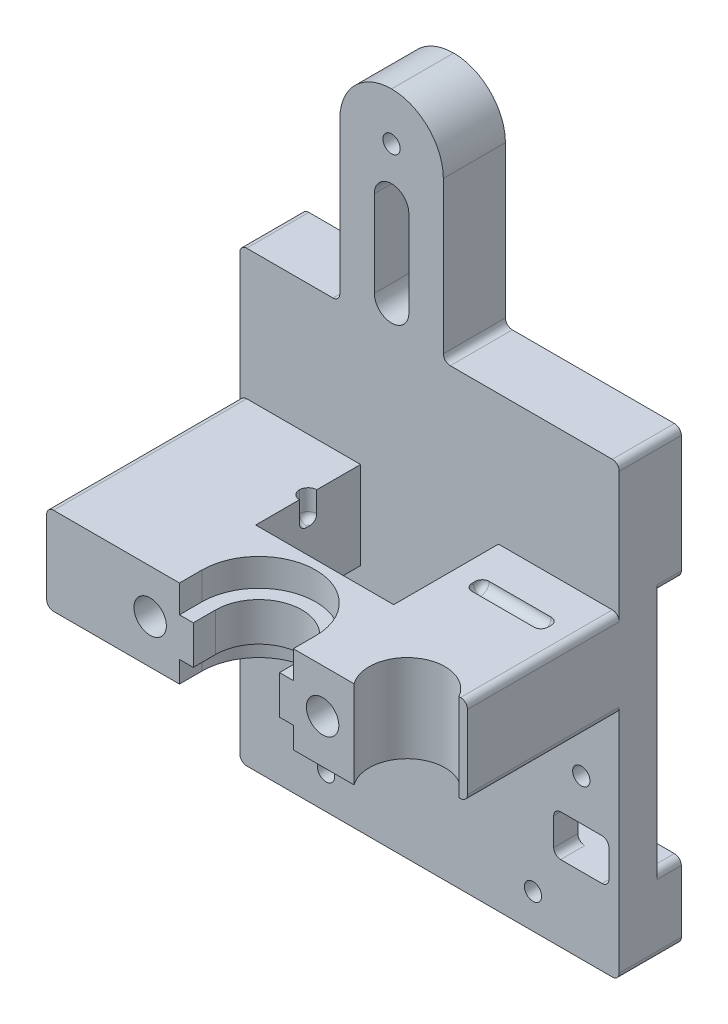
from build123d import *

# Parameters (mm, degrees)
SKETCH1_R           = 1.25
SKETCH1_W           = 8
SKETCH1_H           = 6
BOSS_EXTRUDE1_DEPTH = 9
FILLET1_R           = 7.5
FILLET2_R           = 1
BOSS_EXTRUDE2_DEPTH = 12.7
SKETCH3_W           = 2
SKETCH3_H           = 4
SKETCH3_H_2         = 3.1
SKETCH5_R           = 1.75
CUT_EXTRUDE1_DEPTH  = 10
SKETCH6_R           = 2.35
CUT_EXTRUDE2_DEPTH  = 5
SKETCH7_W           = 2.5
SKETCH7_H           = 4
CUT_EXTRUDE3_DEPTH  = 1.25
FILLET3_R           = 1.25
FILLET4_R           = 1
SKETCH8_W           = 11
SKETCH8_H           = 2.5
CUT_EXTRUDE4_DEPTH  = 1.25
FILLET5_R           = 1.25
FILLET6_R           = 1
SKETCH9_R           = 1.5
CUT_EXTRUDE5_DEPTH  = 8
SKETCH9_3_R         = 2.35
CUT_EXTRUDE6_DEPTH  = 5
SKETCH9_4_R         = 1.25
CUT_EXTRUDE7_DEPTH  = 23
SKETCH10_R          = 1.5
CUT_EXTRUDE8_DEPTH  = 8
SKETCH11_W          = 11
SKETCH11_H          = 35
CUT_EXTRUDE9_DEPTH  = 3.5
SKETCH13_W          = 9.4
SKETCH13_H          = 12
CUT_EXTRUDE10_DEPTH = 1.5
CUT_EXTRUDE11_DEPTH = 33
SKETCH15_W          = 2
SKETCH15_H          = 6
CUT_EXTRUDE12_DEPTH = 1.5
FILLET7_R           = 1
SKETCH16_W          = 8
SKETCH16_H          = 6
CUT_EXTRUDE13_DEPTH = 7.5
CUT_EXTRUDE14_DEPTH = 6
FILLET8_R           = 1


with BuildPart() as part:
    # Sketch1 → Boss-Extrude1 (new body)
    with BuildSketch(Plane.XY):
        Polygon((-27.5, 17.25), (-13, 17.25), (-13, 47.75), (2, 47.75), (2, 17.25), (27.5, 17.25), (27.5, -47.75), (-27.5, -47.75), align=None)
        with Locations((-5.5, 40.85)):
            Circle(SKETCH1_R, mode=Mode.SUBTRACT)
        with Locations((-22, -24.75)):
            Circle(SKETCH1_R, mode=Mode.SUBTRACT)
        with Locations((-15, -42.75)):
            Circle(SKETCH1_R, mode=Mode.SUBTRACT)
        with Locations(Location((15, -42.75, 0), (0, 0, 180))):
            Circle(SKETCH1_R, mode=Mode.SUBTRACT)
        with Locations(Location((22, -24.75, 0), (0, 0, 180))):
            Circle(SKETCH1_R, mode=Mode.SUBTRACT)
        with BuildLine():
            Line((-3, 33.35), (-3, 20.85))
            ThreePointArc((-3, 20.85), (-5.5, 18.35), (-8, 20.85))
            Line((-8, 20.85), (-8, 33.35))
            ThreePointArc((-8, 33.35), (-5.5, 35.85), (-3, 33.35))
        make_face(mode=Mode.SUBTRACT)
        with Locations((22, -33.75)):
            Rectangle(SKETCH1_W, SKETCH1_H, mode=Mode.SUBTRACT)
    extrude(amount=BOSS_EXTRUDE1_DEPTH)

    # Fillet1
    fillet1_edges = [part.edges().sort_by_distance(p)[0] for p in [
        (-13, 47.75, 4.5),
        (2, 47.75, 4.5),
    ]]
    fillet(fillet1_edges, radius=FILLET1_R - 0.0001)  # a hair under: the kernel refuses the full size

    # Fillet2
    fillet2_edges = [part.edges().sort_by_distance(p)[0] for p in [
        (-27.5, 17.25, 4.5),
        (-13, 17.25, 4.5),
        (2, 17.25, 4.5),
        (27.5, 17.25, 4.5),
        (27.5, -47.75, 4.5),
        (-27.5, -47.75, 4.5),
    ]]
    fillet(fillet2_edges, radius=FILLET2_R)

    # Sketch2 → Boss-Extrude2 (add)
    with BuildSketch(Plane(origin=(0, -14.35, 0), x_dir=(-1, 0, 0), z_dir=(0, -1, 0))):
        with BuildLine():
            Line((27.5, -9), (10, -9))
            Line((10, -9), (10, -24.2))
            Line((10, -24.2), (-10, -24.2))
            Line((-10, -24.2), (-10, -9))
            Line((-10, -9), (-27.5, -9))
            Line((-27.5, -9), (-27.5, -31))
            Line((-27.5, -31), (-26.263139721, -31))
            ThreePointArc((-26.263139721, -31), (-18.495572929, -29.143111899), (-17.062940163, -37))
            Line((-17.062940163, -37), (-6.25, -37))
            Line((-6.25, -37), (-6.25, -33.75))
            ThreePointArc((-6.25, -33.75), (0, -27.5), (6.25, -33.75))
            Line((6.25, -33.75), (6.25, -37))
            Line((6.25, -37), (27.5, -37))
            Line((27.5, -37), (27.5, -9))
        make_face()
    extrude(amount=-BOSS_EXTRUDE2_DEPTH)

    # Cut-Sweep1: sweep along a path in Sketch4
    with BuildLine(Plane(origin=(0, -1.65, 0), x_dir=(1, 0, 0), z_dir=(0, 1, 0))) as cut_sweep1_path:
        Line((-6.25, -37), (-6.25, -33.75))
        ThreePointArc((-6.25, -33.75), (0, -27.5), (6.25, -33.75))
        Line((6.25, -33.75), (6.25, -37))
    # Sketch3 → Cut-Sweep1 (sweep, cut)
    with BuildSketch(Plane.XY.offset(37)):
        with Locations((-7.25, -3.65)):
            Rectangle(SKETCH3_W, SKETCH3_H)
        with Locations((-7.25, -12.8)):
            Rectangle(SKETCH3_W, SKETCH3_H_2)
    sweep(path=cut_sweep1_path.line, mode=Mode.SUBTRACT)

    # Sketch5 → Cut-Extrude1 (cut)
    with BuildSketch(Plane.XY.offset(37)):
        with Locations((-12.5, -8)):
            Circle(SKETCH5_R)
        with Locations(Location((12.5, -8, 0), (0, 0, 180))):
            Circle(SKETCH5_R)
    extrude(amount=-CUT_EXTRUDE1_DEPTH, mode=Mode.SUBTRACT)

    # Sketch6 → Cut-Extrude2 (cut)
    with BuildSketch(Plane.XY.offset(37)):
        with Locations((-12.5, -8)):
            Circle(SKETCH6_R)
        with Locations((12.5, -8)):
            Circle(SKETCH6_R)
    extrude(amount=-CUT_EXTRUDE2_DEPTH, mode=Mode.SUBTRACT)

    # Sketch7 → Cut-Extrude3 (cut)
    with BuildSketch(Plane(origin=(-10, 0, 0), x_dir=(0, 0, -1), z_dir=(1, 0, 0))):
        with Locations((-16.6, -3.65)):
            Rectangle(SKETCH7_W, SKETCH7_H)
    extrude(amount=-CUT_EXTRUDE3_DEPTH, mode=Mode.SUBTRACT)

    # Fillet3
    fillet3_edges = [part.edges().sort_by_distance(p)[0] for p in [
        (-11.25, -3.65, 17.85),
        (-11.25, -3.65, 15.35),
    ]]
    fillet(fillet3_edges, radius=FILLET3_R - 0.0001)  # a hair under: the kernel refuses the full size

    # Fillet4
    fillet4_edges = [part.edges().sort_by_distance(p)[0] for p in [
        (-10.883912766, -5.65, 15.716087234),
        (-10.883912766, -5.65, 17.483912766),
    ]]
    fillet(fillet4_edges, radius=FILLET4_R)

    # Sketch8 → Cut-Extrude4 (cut)
    with BuildSketch(Plane(origin=(0, -1.65, 0), x_dir=(1, 0, 0), z_dir=(0, 1, 0))):
        with Locations((18.5, -15.6)):
            Rectangle(SKETCH8_W, SKETCH8_H)
    extrude(amount=-CUT_EXTRUDE4_DEPTH, mode=Mode.SUBTRACT)

    # Fillet5
    fillet5_edges = [part.edges().sort_by_distance(p)[0] for p in [
        (18.5, -2.9, 16.85),
        (18.5, -2.9, 14.35),
    ]]
    fillet(fillet5_edges, radius=FILLET5_R - 0.0001)  # a hair under: the kernel refuses the full size

    # Fillet6
    fillet6_edges = [part.edges().sort_by_distance(p)[0] for p in [
        (24, -2.533912766, 14.716087234),
        (24, -2.533912766, 16.483912766),
        (13, -2.533912766, 14.716087234),
        (13, -2.533912766, 16.483912766),
    ]]
    fillet(fillet6_edges, radius=FILLET6_R)

    # Sketch9 → Cut-Extrude5 (cut)
    with BuildSketch(Plane(origin=(0, 0, 0), x_dir=(-1, 0, 0), z_dir=(0, 0, -1))):
        with Locations((-12, -3.25)):
            Circle(SKETCH9_R)
        with Locations((-12, -27.25)):
            Circle(SKETCH9_R)
        with Locations(Location((12, -27.25, 0), (0, 0, 180))):
            Circle(SKETCH9_R)
        with Locations(Location((12, -3.25, 0), (0, 0, 180))):
            Circle(SKETCH9_R)
    extrude(amount=-CUT_EXTRUDE5_DEPTH, mode=Mode.SUBTRACT)

    # Sketch9<3> → Cut-Extrude6 (cut)
    with BuildSketch(Plane(origin=(0, 0, 0), x_dir=(-1, 0, 0), z_dir=(0, 0, -1))):
        with Locations((0, -15.25)):
            Circle(SKETCH9_3_R)
    extrude(amount=-CUT_EXTRUDE6_DEPTH, mode=Mode.SUBTRACT)

    # Sketch9<4> → Cut-Extrude7 (cut)
    with BuildSketch(Plane(origin=(0, 0, 0), x_dir=(-1, 0, 0), z_dir=(0, 0, -1))):
        with Locations((-22, -5.75)):
            Circle(SKETCH9_4_R)
        with Locations(Location((22, -5.75, 0), (0, 0, 180))):
            Circle(SKETCH9_4_R)
    extrude(amount=-CUT_EXTRUDE7_DEPTH, mode=Mode.SUBTRACT)

    # Sketch10 → Cut-Extrude8 (cut)
    with BuildSketch(Plane(origin=(0, 0, 0), x_dir=(-1, 0, 0), z_dir=(0, 0, -1))):
        with Locations((0, -15.25)):
            Circle(SKETCH10_R)
    extrude(amount=-CUT_EXTRUDE8_DEPTH, mode=Mode.SUBTRACT)

    # Sketch11 → Cut-Extrude9 (cut)
    with BuildSketch(Plane(origin=(0, 0, 0), x_dir=(-1, 0, 0), z_dir=(0, 0, -1))):
        with Locations((-22, -19.25)):
            Rectangle(SKETCH11_W, SKETCH11_H)
    cut_extrude9 = extrude(amount=-CUT_EXTRUDE9_DEPTH, mode=Mode.SUBTRACT)

    # Sketch13 → Cut-Extrude10 (cut)
    with BuildSketch(Plane(origin=(0, 0, 3.5), x_dir=(-1, 0, 0), z_dir=(0, 0, -1))):
        with Locations((-22, -15.25)):
            Rectangle(SKETCH13_W, SKETCH13_H)
    cut_extrude10 = extrude(amount=-CUT_EXTRUDE10_DEPTH, mode=Mode.SUBTRACT)

    # Mirror1: Cut-Extrude9, Cut-Extrude10 across plane
    add(cut_extrude9.mirror(Plane(origin=(0, 0, 0), x_dir=(0, 0, 1), z_dir=(1, 0, 0))), mode=Mode.SUBTRACT)
    add(cut_extrude10.mirror(Plane(origin=(0, 0, 0), x_dir=(0, 0, 1), z_dir=(1, 0, 0))), mode=Mode.SUBTRACT)

    # Sketch12 → Cut-Extrude11 (cut)
    with BuildSketch(Plane(origin=(16.5, 0, 0), x_dir=(0, 0, -1), z_dir=(1, 0, 0))):
        Polygon((-3.5, -30.75), (-2.5, -30.75), (-2.5, -36.75), (-5.5, -36.75), (-5.5, -30.75), align=None)
    extrude(amount=-CUT_EXTRUDE11_DEPTH, mode=Mode.SUBTRACT)

    # Sketch15 → Cut-Extrude12 (cut)
    with BuildSketch(Plane(origin=(18, 0, 0), x_dir=(0, 0, -1), z_dir=(1, 0, 0))):
        with Locations((-4.5, -33.75)):
            Rectangle(SKETCH15_W, SKETCH15_H)
    extrude(amount=-CUT_EXTRUDE12_DEPTH, mode=Mode.SUBTRACT)

    # Fillet7
    fillet7_edges = [part.edges().sort_by_distance(p)[0] for p in [
        (27.5, -36.75, 1.75),
        (27.5, -1.75, 1.75),
        (18, -30.75, 7.25),
        (-27.5, -1.75, 1.75),
        (-27.5, -36.75, 1.75),
        (18, -36.75, 7.25),
        (26, -36.75, 6.25),
        (26, -30.75, 6.25),
    ]]
    fillet(fillet7_edges, radius=FILLET7_R)

    # Sketch16 → Cut-Extrude13 (cut)
    with BuildSketch(Plane(origin=(0, 0, 0), x_dir=(-1, 0, 0), z_dir=(0, 0, -1))):
        with Locations((22, -33.75)):
            Rectangle(SKETCH16_W, SKETCH16_H)
    extrude(amount=-CUT_EXTRUDE13_DEPTH, mode=Mode.SUBTRACT)

    # Sketch17 → Cut-Extrude14 (cut)
    with BuildSketch(Plane(origin=(0, -36.75, 0), x_dir=(1, 0, 0), z_dir=(0, 1, 0))):
        Polygon((-18, -7.5), (-18, -3.5), (-16.5, -3.5), (-16.5, -5.5), align=None)
    extrude(amount=CUT_EXTRUDE14_DEPTH, mode=Mode.SUBTRACT)

    # Fillet8
    fillet8_edges = [part.edges().sort_by_distance(p)[0] for p in [
        (-27.5, -1.65, 23),
        (27.5, -1.65, 20),
        (-27.5, -14.35, 23),
        (27.5, -14.35, 20),
    ]]
    fillet(fillet8_edges, radius=FILLET8_R)


solid = part.part
